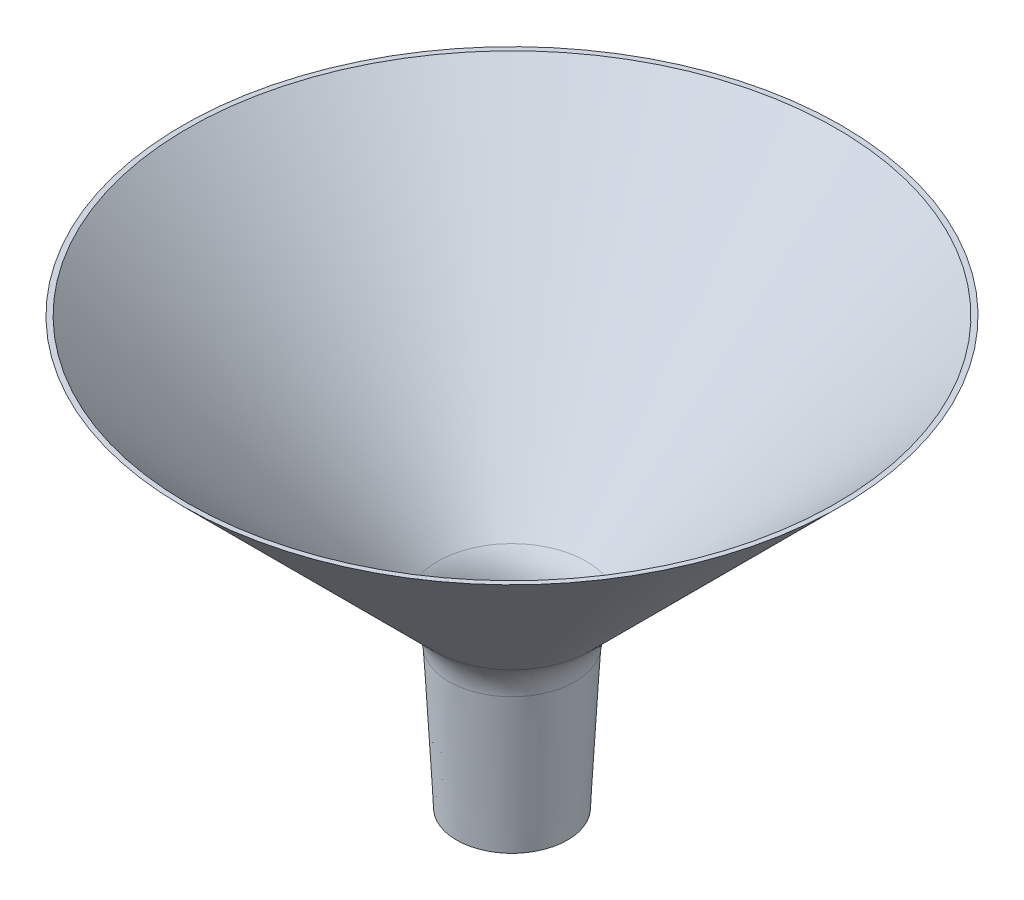
from build123d import *

# Parameters (mm, degrees)
FILLET1_R = 8
FILLET2_R = 8


with BuildPart() as part:
    # Sketch1 → Revolve1 (revolve)
    with BuildSketch(Plane.XY):
        Polygon((8, 0), (9.310194482, 25), (50, 65.689805518), (50.777817459, 65.689805518), (9.848391286, 24.760379345), (8.55075479, 0), align=None)
    revolve(axis=Axis((0, -2.9, 0), (0, 1, 0)))

    # Fillet1
    fillet1_edges = [part.edges().sort_by_distance(p)[0] for p in [
        (-9.848391286, 24.760379345, 0),
    ]]
    fillet(fillet1_edges, radius=FILLET1_R)

    # Fillet2
    fillet2_edges = [part.edges().sort_by_distance(p)[0] for p in [
        (-9.310194482, 25, 0),
    ]]
    fillet(fillet2_edges, radius=FILLET2_R)


solid = part.part
